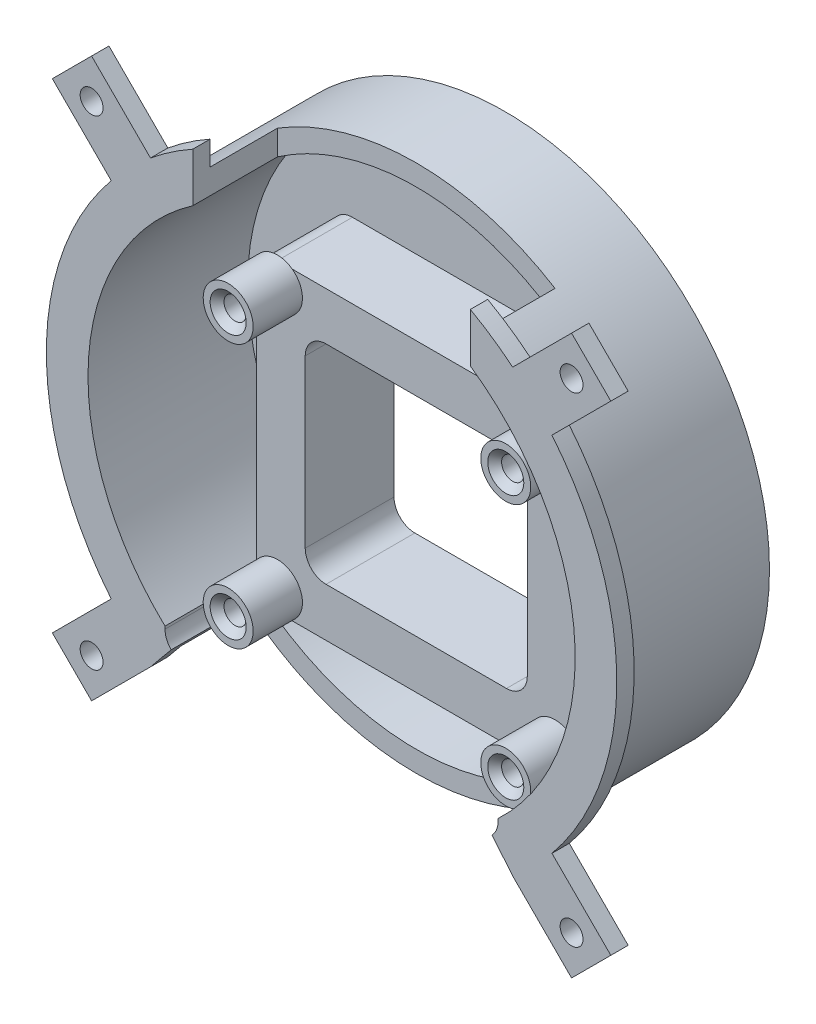
from build123d import *

# Parameters (mm, degrees)
BOSS_EXTRUDE1_DEPTH     = 10.8
CUT_EXTRUDE1_DEPTH      = 63.509359299
CUT_EXTRUDE1_DEPTH_BACK = 63.509359299
SKETCH14_W              = 32
SKETCH14_H              = 30
CUT_EXTRUDE3_DEPTH      = 60.51688836
FILLET1_R               = 3
SKETCH16_R              = 1.6
CUT_EXTRUDE2_DEPTH      = 60.51688836
CUT_EXTRUDE4_DEPTH      = 75.590213715
BOSS_EXTRUDE3_START     = -2.5
SKETCH22_R              = 1.65
BOSS_EXTRUDE3_DEPTH     = 2.5
BOSS_EXTRUDE4_START     = 7.1
SKETCH24_R              = 3.6
SKETCH24_R_2            = 1.6
BOSS_EXTRUDE4_DEPTH     = 7.1
CHAMFER1_SIZE           = 1
CUT_EXTRUDE5_START      = -12.2
CUT_EXTRUDE5_DEPTH      = 12.2


# Read off the part's stored shape, not the designer's step: Cut-Extrude5
with BuildPart() as part:
    # Sketch6 → Revolve1 (revolve)
    with BuildSketch(Plane(origin=(0, 0, 0), x_dir=(0, 0, -1), z_dir=(1, 0, 0)), mode=Mode.PRIVATE) as revolve1_sk:
        Polygon((-2, 25.4), (-2, 35.1), (-25, 35.1), (-25, 37.95), (-25, 41.1), (-22.5, 41.1), (-22.5, 38.1), (0, 38.1), (0, 25.4), (0, 0), (-2, 0), align=None)
    revolve(revolve1_sk.sketch.rotate(Axis((0, 0, 0), (0, 0, 1)), 90), axis=Axis((0, 0, 0), (0, 0, 1)))

    # Sketch15 → Boss-Extrude1 (add)
    with BuildSketch(Plane.XY.offset(2)):
        with BuildLine():
            Line((-20, 15.904297927), (20, 15.904297927))
            ThreePointArc((20, 15.904297927), (22.121320344, 15.02561827), (23, 12.904297927))
            Line((23, 12.904297927), (23, -24.995702073))
            ThreePointArc((23, -24.995702073), (22.121320344, -27.117022417), (20, -27.995702073))
            Line((20, -27.995702073), (-20, -27.995702073))
            ThreePointArc((-20, -27.995702073), (-22.121320344, -27.117022417), (-23, -24.995702073))
            Line((-23, -24.995702073), (-23, 12.904297927))
            ThreePointArc((-23, 12.904297927), (-22.121320344, 15.02561827), (-20, 15.904297927))
        make_face()
    extrude(amount=BOSS_EXTRUDE1_DEPTH)

    # Sketch14 → Cut-Extrude1 (cut, two sides: drawn at the far end of the back side and taken through both)
    with BuildSketch(Plane.XY.offset(2).offset(-CUT_EXTRUDE1_DEPTH_BACK)):
        with Locations((-0.00164643, -5.995702073)):
            Rectangle(SKETCH14_W, SKETCH14_H)
    extrude(amount=CUT_EXTRUDE1_DEPTH + CUT_EXTRUDE1_DEPTH_BACK, mode=Mode.SUBTRACT)

    # Sketch18 → Cut-Extrude3 (cut, through all)
    with BuildSketch(Plane.XY.offset(12.8)):
        with BuildLine():
            Line((19.99835357, -24.995702073), (23.99835357, -24.995702073))
            Line((23.99835357, -24.995702073), (23.99835357, -25.995702073))
            ThreePointArc((23.99835357, -25.995702073), (23.119673914, -28.117022417), (20.99835357, -28.995702073))
            Line((20.99835357, -28.995702073), (19.99835357, -28.995702073))
            Line((19.99835357, -28.995702073), (19.99835357, -24.995702073))
        make_face()
        with BuildLine():
            Line((-20.00164643, -24.995702073), (-24.00164643, -24.995702073))
            Line((-24.00164643, -24.995702073), (-24.00164643, -25.995702073))
            ThreePointArc((-24.00164643, -25.995702073), (-23.122966774, -28.117022417), (-21.00164643, -28.995702073))
            Line((-21.00164643, -28.995702073), (-20.00164643, -28.995702073))
            Line((-20.00164643, -28.995702073), (-20.00164643, -24.995702073))
        make_face()
    extrude(amount=CUT_EXTRUDE3_DEPTH, mode=Mode.SUBTRACT)

    # Fillet1
    fillet1_edges = [part.edges().sort_by_distance(p)[0] for p in [
        (-16.00164643, 9.004297927, 6.4),
        (-16.00164643, -20.995702073, 6.4),
        (15.99835357, -20.995702073, 6.4),
        (15.99835357, 9.004297927, 6.4),
    ]]
    fillet(fillet1_edges, radius=FILLET1_R)

    # Sketch16 → Cut-Extrude2 (cut, through all)
    with BuildSketch(Plane.XY.offset(12.8)):
        with Locations((-20.00164643, 13.004297927)):
            Circle(SKETCH16_R)
        with Locations((-20.00164643, -24.995702073)):
            Circle(SKETCH16_R)
        with Locations((19.99835357, -24.995702073)):
            Circle(SKETCH16_R)
        with Locations((19.99835357, 13.004297927)):
            Circle(SKETCH16_R)
    extrude(amount=-CUT_EXTRUDE2_DEPTH, mode=Mode.SUBTRACT)

    # Sketch20 → Cut-Extrude4 (cut, through all)
    with BuildSketch(Plane(origin=(0, 15.904297927, 0), x_dir=(1, 0, 0), z_dir=(0, 1, 0))):
        Polygon((20, -12.8), (-20, -12.8), (-20, -25), (19.99835357, -25), align=None)
    extrude(amount=CUT_EXTRUDE4_DEPTH, mode=Mode.SUBTRACT)

    # Sketch22 → Boss-Extrude3 (add)
    # profile 1 of 2: a face of its own
    with BuildSketch(Plane.XY.offset(25).offset(BOSS_EXTRUDE3_START)):
        with BuildLine():
            Line((-40.237833378, 34.580979128), (-31.752552003, 26.095697754))
            ThreePointArc((-31.752552003, 26.095697754), (-29.062088707, 29.062088707), (-26.095697754, 31.752552003))
            Line((-26.095697754, 31.752552003), (-34.580979128, 40.237833378))
            Line((-34.580979128, 40.237833378), (-40.237833378, 34.580979128))
        make_face()
        with Locations((-34.580979128, 34.580979128)):
            Circle(SKETCH22_R, mode=Mode.SUBTRACT)
    # profile 2 of 2: a face of its own
    with BuildSketch(Plane.XY.offset(25).offset(BOSS_EXTRUDE3_START)):
        with BuildLine():
            ThreePointArc((26.095697754, 31.752552003), (29.062088707, 29.062088707), (31.752552003, 26.095697754))
            Line((31.752552003, 26.095697754), (40.237833378, 34.580979128))
            Line((40.237833378, 34.580979128), (34.580979128, 40.237833378))
            Line((34.580979128, 40.237833378), (26.095697754, 31.752552003))
        make_face()
        with Locations((34.580979128, 34.580979128)):
            Circle(SKETCH22_R, mode=Mode.SUBTRACT)
    boss_extrude3 = extrude(amount=BOSS_EXTRUDE3_DEPTH)

    # Sketch24 → Boss-Extrude4 (add)
    # profile 1 of 4: a face of its own
    with BuildSketch(Plane.XY.offset(12.8).offset(BOSS_EXTRUDE4_START)):
        with Locations(Location((-20.00164643, 13.004297927, 0), (0, 0, 213.6046846))):
            Circle(SKETCH24_R)
        with Locations((-20.00164643, 13.004297927)):
            Circle(SKETCH24_R_2, mode=Mode.SUBTRACT)
    # profile 2 of 4: a face of its own
    with BuildSketch(Plane.XY.offset(12.8).offset(BOSS_EXTRUDE4_START)):
        with Locations(Location((19.99835357, 13.004297927, 0), (0, 0, 126.336057515))):
            Circle(SKETCH24_R)
        with Locations((19.99835357, 13.004297927)):
            Circle(SKETCH24_R_2, mode=Mode.SUBTRACT)
    # profile 3 of 4: a face of its own
    with BuildSketch(Plane.XY.offset(12.8).offset(BOSS_EXTRUDE4_START)):
        with Locations(Location((-20.00164643, -24.995702073, 0), (0, 0, 198.741091164))):
            Circle(SKETCH24_R)
        with Locations((-20.00164643, -24.995702073)):
            Circle(SKETCH24_R_2, mode=Mode.SUBTRACT)
    # profile 4 of 4: a face of its own
    with BuildSketch(Plane.XY.offset(12.8).offset(BOSS_EXTRUDE4_START)):
        with Locations(Location((19.99835357, -24.995702073, 0), (0, 0, 236.442690237))):
            Circle(SKETCH24_R)
        with Locations((19.99835357, -24.995702073)):
            Circle(SKETCH24_R_2, mode=Mode.SUBTRACT)
    extrude(amount=-BOSS_EXTRUDE4_DEPTH)

    # Chamfer1
    chamfer1_edges = [part.edges().sort_by_distance(p)[0] for p in [
        (-21.60164643, 13.004297927, 19.9),
        (18.39835357, 13.004297927, 19.9),
        (-21.60164643, -24.995702073, 19.9),
        (18.39835357, -24.995702073, 19.9),
    ]]
    chamfer(chamfer1_edges, length=CHAMFER1_SIZE)

    # Mirror1: Boss-Extrude3 across plane
    add(boss_extrude3.mirror(Plane.ZX))

    # Cut-Extrude5 outline → Cut-Extrude5 (cut)
    with BuildSketch(Plane.XY.offset(25).offset(CUT_EXTRUDE5_START)):
        with BuildLine():
            ThreePointArc((-26.095697754, -31.752552003), (0, -41.1), (26.095697754, -31.752552003))
            Line((26.095697754, -31.752552003), (23.119673914, -28.117022417))
            ThreePointArc((23.119673914, -28.117022417), (22.146403867, -28.767340671), (20.99835357, -28.995702073))
            Line((20.99835357, -28.995702073), (19.99835357, -28.995702073))
            Line((19.99835357, -28.995702073), (19.99835357, -28.845725064))
            ThreePointArc((19.99835357, -28.845725064), (-0.002003485, -35.099999943), (-20.00164643, -28.843441891))
            Line((-20.00164643, -28.843441891), (-20.00164643, -28.995702073))
            Line((-20.00164643, -28.995702073), (-21.00164643, -28.995702073))
            ThreePointArc((-21.00164643, -28.995702073), (-22.144276194, -28.769579725), (-23.11465654, -28.125300222))
            Line((-23.11465654, -28.125300222), (-26.095697754, -31.752552003))
        make_face()
    extrude(amount=CUT_EXTRUDE5_DEPTH, mode=Mode.SUBTRACT)


solid = part.part
